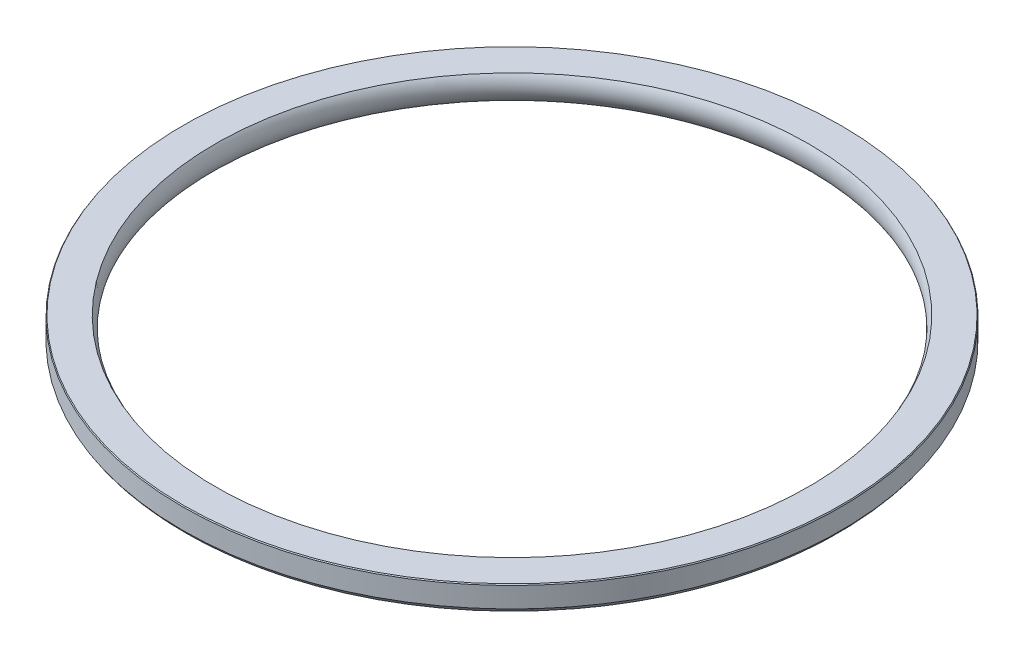
from build123d import *


with BuildPart() as part:
    # Schizzo1 → Rivoluzione1 (revolve)
    with BuildSketch(Plane.XY):
        with BuildLine():
            Line((-13.510616699, 0.51), (-14.969383301, 0.51))
            ThreePointArc((-14.969383301, 0.51), (-14.985060122, 0.486811477), (-15, 0.463141447))
            Line((-15, 0.463141447), (-15, -0.463141447))
            ThreePointArc((-15, -0.463141447), (-13.999479731, -0.856883889), (-13.35, 0))
            ThreePointArc((-13.35, 0), (-13.391103323, 0.267347024), (-13.510616699, 0.51))
        make_face()
    revolve(axis=Axis((0, 0, 0), (0, 1, 0)))


solid = part.part
